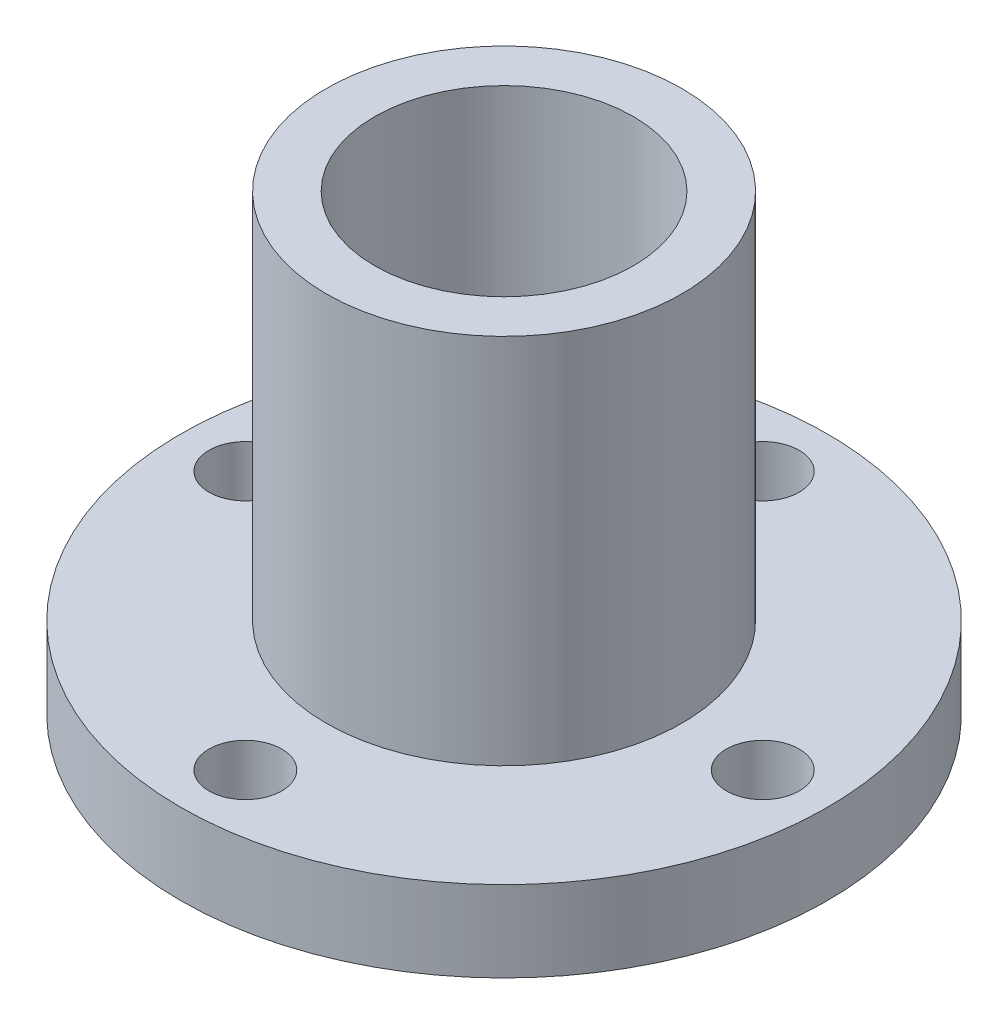
from build123d import *

# Parameters (mm, degrees)
SKETCH_1_R          = 20
EXTRUDE_1_DEPTH     = 28
SKETCH_2_OUTSIDE_W  = 54.624
SKETCH_2_OUTSIDE_H  = 54.624
SKETCH_2_OUTSIDE_R  = 11
CUT_EXTRUDE_1_DEPTH = 23
SKETCH_3_R          = 8
CUT_EXTRUDE_2_DEPTH = 28
SKETCH_4_R          = 2.25
CUT_EXTRUDE_3_DEPTH = 5


with BuildPart() as part:
    # 草图1 → 凸台-拉伸1 (new body)
    with BuildSketch(Plane(origin=(0, 0, 0), x_dir=(1, 0, 0), z_dir=(0, 1, 0))):
        Circle(SKETCH_1_R)
    extrude(amount=EXTRUDE_1_DEPTH)

    # 草图2 outside → 切除-拉伸1 (cut)
    with BuildSketch(Plane(origin=(0, 28, 0), x_dir=(1, 0, 0), z_dir=(0, 1, 0))):
        Rectangle(SKETCH_2_OUTSIDE_W, SKETCH_2_OUTSIDE_H)
        Circle(SKETCH_2_OUTSIDE_R, mode=Mode.SUBTRACT)
    extrude(amount=-CUT_EXTRUDE_1_DEPTH, mode=Mode.SUBTRACT)

    # 草图3 → 切除-拉伸2 (cut)
    with BuildSketch(Plane(origin=(0, 28, 0), x_dir=(1, 0, 0), z_dir=(0, 1, 0))):
        Circle(SKETCH_3_R)
    extrude(amount=-CUT_EXTRUDE_2_DEPTH, mode=Mode.SUBTRACT)

    # 草图4 → 切除-拉伸3 (cut)
    with BuildSketch(Plane.XZ):
        with Locations((0, 16)):
            Circle(SKETCH_4_R)
        with Locations((16, 0)):
            Circle(SKETCH_4_R)
        with Locations((0, -16)):
            Circle(SKETCH_4_R)
        with Locations((-16, 0)):
            Circle(SKETCH_4_R)
    extrude(amount=-CUT_EXTRUDE_3_DEPTH, mode=Mode.SUBTRACT)


solid = part.part
